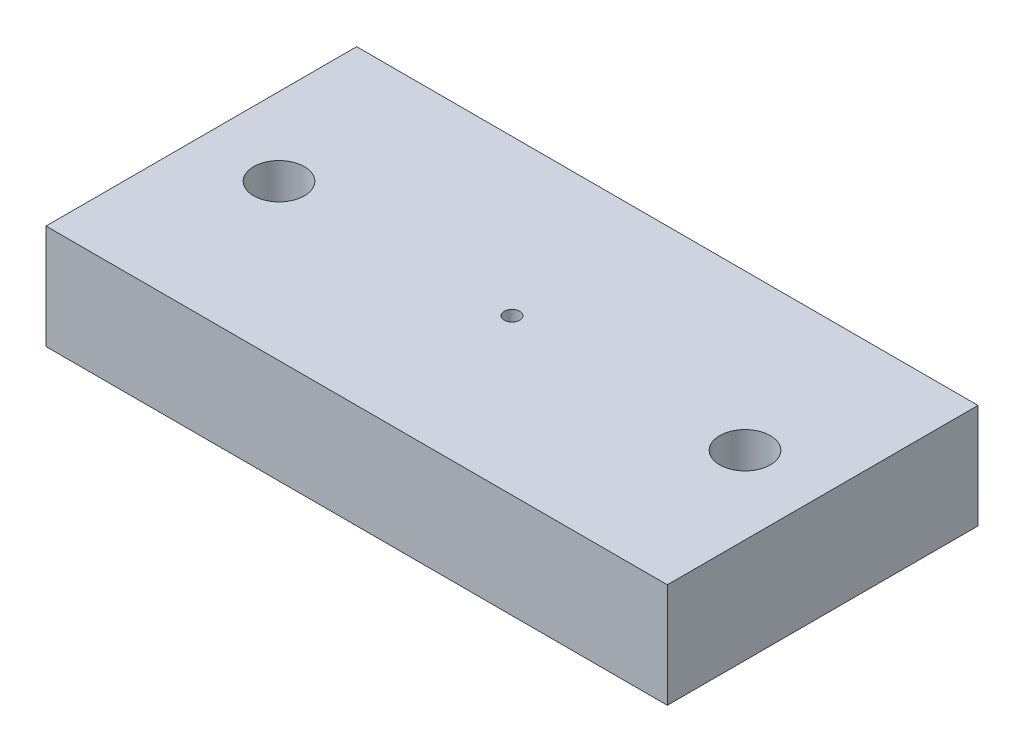
from build123d import *

# Parameters (mm, degrees)
SKETCH1_W           = 40
SKETCH1_H           = 20
BOSS_EXTRUDE1_DEPTH = 6.72
SKETCH2_R           = 0.5
CUT_EXTRUDE1_DEPTH  = 6.72
LPATTERN1_COUNT     = 2
LPATTERN1_PITCH     = 30
SKETCH12_R          = 5.05
SKETCH12_R_2        = 4
CUT_EXTRUDE2_DEPTH  = 4.72
SKETCH13_W          = 5
SKETCH13_H          = 3.5
CUT_EXTRUDE3_DEPTH  = 0.5


with BuildPart() as part:
    # Sketch1 → Boss-Extrude1 (new body)
    with BuildSketch(Plane(origin=(0, 0, 0), x_dir=(1, 0, 0), z_dir=(0, 1, 0))):
        Rectangle(SKETCH1_W, SKETCH1_H)
    extrude(amount=BOSS_EXTRUDE1_DEPTH)

    # Sketch2 → Cut-Extrude1 (cut)
    with BuildSketch(Plane(origin=(0, 6.72, 0), x_dir=(1, 0, 0), z_dir=(0, 1, 0))):
        Circle(SKETCH2_R)
    extrude(amount=-CUT_EXTRUDE1_DEPTH, mode=Mode.SUBTRACT)

    # Sketch9 → CBORE for #4 Pan Head Machine Screw3 (revolve, cut)
    with BuildSketch(Plane(origin=(-15, 0, 0), x_dir=(0, 0, -1), z_dir=(1, 0, 0))):
        Polygon((0, 0), (0, 6.72), (1.63195, 6.72), (1.63195, 2.032), (3.175, 2.032), (3.175, 0.635), (3.81, 0), align=None)
    cbore_for_4_pan_head_machine_screw3 = revolve(axis=Axis((-15, -6.35, 0), (0, 1, 0)), mode=Mode.SUBTRACT)

    # LPattern1: CBORE for #4 Pan Head Machine Screw3 ×2
    with Locations(*[(i * LPATTERN1_PITCH, 0, 0) for i in range(1, LPATTERN1_COUNT)]):
        add(cbore_for_4_pan_head_machine_screw3, mode=Mode.SUBTRACT)

    # Sketch12 → Cut-Extrude2 (cut)
    with BuildSketch(Plane.XZ):
        Circle(SKETCH12_R)
        Circle(SKETCH12_R_2, mode=Mode.SUBTRACT)
    extrude(amount=-CUT_EXTRUDE2_DEPTH, mode=Mode.SUBTRACT)

    # Sketch13 → Cut-Extrude3 (cut)
    with BuildSketch(Plane.XZ):
        Rectangle(SKETCH13_W, SKETCH13_H)
    extrude(amount=-CUT_EXTRUDE3_DEPTH, mode=Mode.SUBTRACT)


solid = part.part
